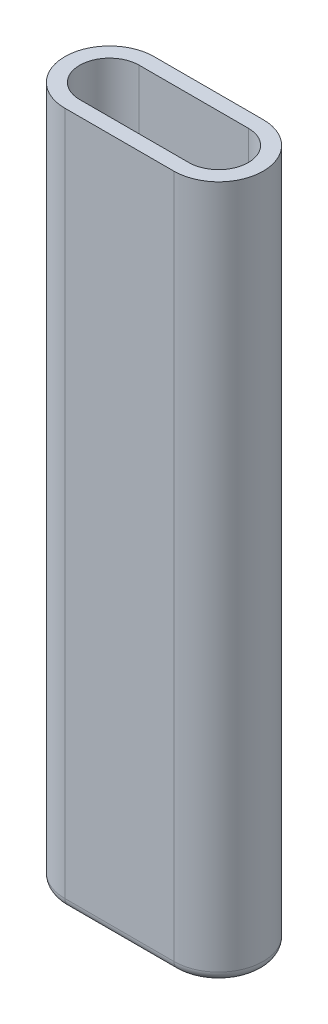
from build123d import *

# Parameters (mm, degrees)
DODANIE_WYCI_GNI_CIE1_DEPTH = 70
SKORUPA1_T                  = -1.5
SZKIC2_W                    = 2
SZKIC2_H                    = 6
DODANIE_WYCI_GNI_CIE2_DEPTH = 50
ZAOKR_GLENIE2_R             = 1


with BuildPart() as part:
    # Szkic1 → Dodanie-wyciągnięcie1 (new body)
    with BuildSketch(Plane(origin=(0, 0, 0), x_dir=(1, 0, 0), z_dir=(0, 1, 0))):
        with BuildLine():
            Line((-5.5, 4.5), (5.5, 4.5))
            ThreePointArc((5.5, 4.5), (10, 0), (5.5, -4.5))
            Line((5.5, -4.5), (-5.5, -4.5))
            ThreePointArc((-5.5, -4.5), (-10, 0), (-5.5, 4.5))
        make_face()
    extrude(amount=DODANIE_WYCI_GNI_CIE1_DEPTH)

    # Skorupa1
    skorupa1_openings = [part.faces().sort_by_distance(p)[0] for p in [
        (0, 70, 0),
    ]]
    offset(amount=SKORUPA1_T, openings=skorupa1_openings, kind=Kind.INTERSECTION)

    # Szkic2 → Dodanie-wyciągnięcie2 (add)
    with BuildSketch(Plane(origin=(0, 1.5, 0), x_dir=(1, 0, 0), z_dir=(0, 1, 0))):
        Rectangle(SZKIC2_W, SZKIC2_H)
    extrude(amount=DODANIE_WYCI_GNI_CIE2_DEPTH)

    # Zaokrąglenie2
    zaokr_glenie2_edges = [part.edges().sort_by_distance(p)[0] for p in [
        (0, 0, -4.5),
        (10, 0, 0),
        (0, 0, 4.5),
        (-10, 0, 0),
        (-1, 51.5, 0),
        (1, 51.5, 0),
    ]]
    fillet(zaokr_glenie2_edges, radius=ZAOKR_GLENIE2_R - 0.0001)  # a hair under: the kernel refuses the full size


solid = part.part
